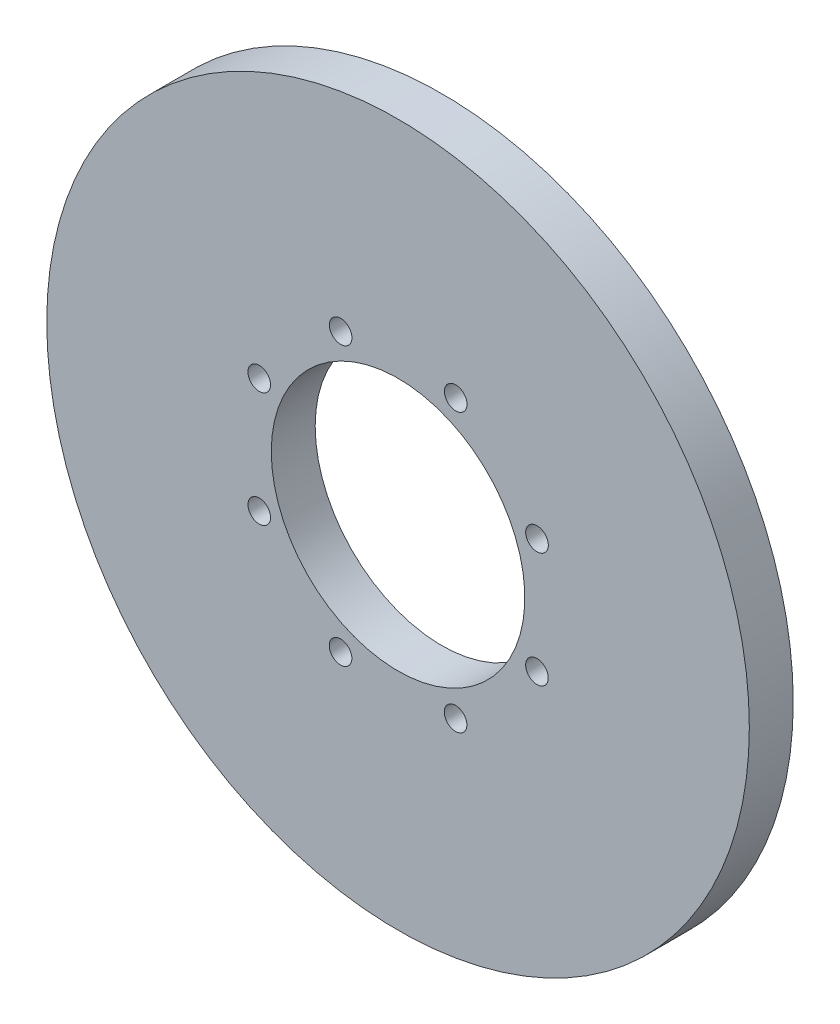
from build123d import *

# Parameters (mm, degrees)
SKETCH1_R               = 152.4
BOSS_EXTRUDE1_DEPTH     = 19.05
SKETCH5_R               = 55
CUT_EXTRUDE1_DEPTH      = 217.366407975
F_3_8_CLEARANCE_HOLE1_D = 9.8044


with BuildPart() as part:
    # Sketch1 → Boss-Extrude1 (new body)
    with BuildSketch(Plane.XY):
        Circle(SKETCH1_R)
    extrude(amount=BOSS_EXTRUDE1_DEPTH)

    # Sketch5 → Cut-Extrude1 (cut, through all)
    with BuildSketch(Plane(origin=(0, 0, 0), x_dir=(-1, 0, 0), z_dir=(0, 0, -1))):
        Circle(SKETCH5_R)
    extrude(amount=-CUT_EXTRUDE1_DEPTH, mode=Mode.SUBTRACT)

    # 3/8 Clearance Hole1 (through all)
    with Locations(Plane.XY.offset(19.05)):
        with Locations((60.285109168, 24.861699689), (60.262270723, -25.040419345), (-24.942124319, -60.287558469), (-60.212101884, -24.985282473), (24.959994735, -60.310396903), (-60.212101884, 24.861699689), (-24.88698742, 60.186814133), (25.015131626, 60.163975676)):
            Hole(F_3_8_CLEARANCE_HOLE1_D / 2)


solid = part.part
